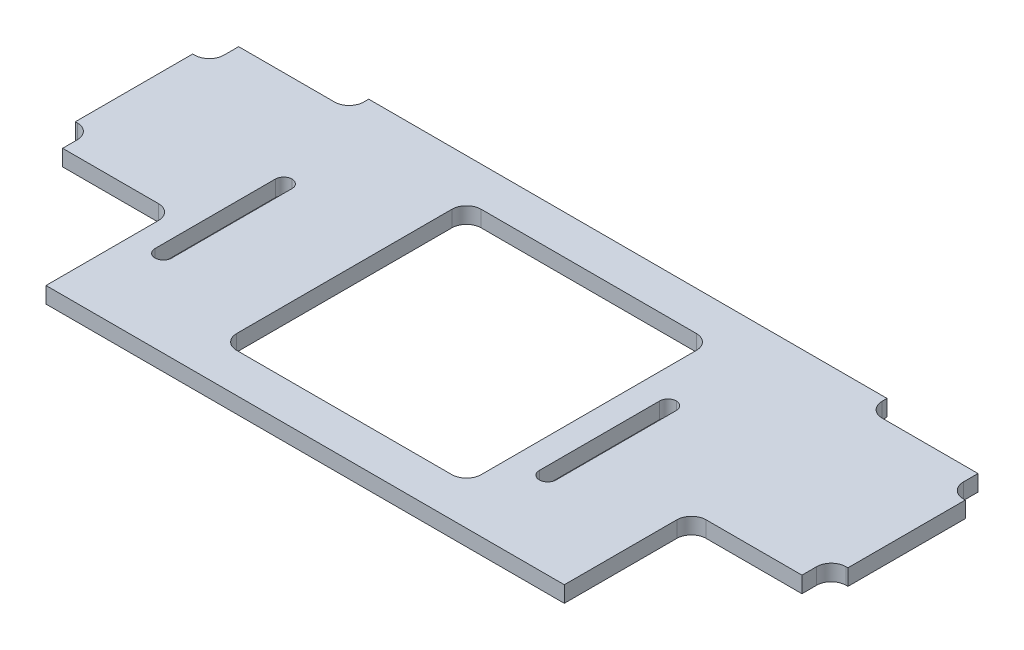
from build123d import *

# Parameters (mm, degrees)
SKIZZE1_W                       = 1.7
SKIZZE1_H                       = 14
SKIZZE1_W_2                     = 25
SKIZZE1_H_2                     = 25
AUFSATZ_LINEAR_AUSTRAGEN1_DEPTH = 0.825
VERRUNDUNG1_R                   = 1.5
VERRUNDUNG2_R                   = 0.85


with BuildPart() as part:
    # Skizze1 → Aufsatz-Linear austragen1 (new, symmetric)
    # profile 1 of 3: a face of its own
    with BuildSketch(Plane(origin=(0, 0, 0), x_dir=(1, 0, 0), z_dir=(0, 1, 0))):
        Polygon((26.5, 16), (26.5, 18), (-26.5, 18), (-26.5, 16), (-26.5, -2), (-26.5, -15), (26.5, -15), (26.5, -2), align=None)
        with Locations((-23.35, 0)):
            Rectangle(SKIZZE1_W, SKIZZE1_H, mode=Mode.SUBTRACT)
        with Locations((15.95, 0)):
            Rectangle(SKIZZE1_W, SKIZZE1_H, mode=Mode.SUBTRACT)
        with Locations((0, 1.5)):
            Rectangle(SKIZZE1_W_2, SKIZZE1_H_2, mode=Mode.SUBTRACT)
    # profile 2 of 3: a face of its own
    with BuildSketch(Plane(origin=(0, 0, 0), x_dir=(1, 0, 0), z_dir=(0, 1, 0))):
        Polygon((-26.5, -2), (-26.5, 16), (-37.8, 16), (-37.8, 13), (-39.5, 13), (-39.5, 1), (-37.8, 1), (-37.8, -2), align=None)
    # profile 3 of 3: a face of its own
    with BuildSketch(Plane(origin=(0, 0, 0), x_dir=(1, 0, 0), z_dir=(0, 1, 0))):
        Polygon((37.8, 16), (26.5, 16), (26.5, -2), (37.8, -2), (37.8, 1), (39.5, 1), (39.5, 13), (37.8, 13), align=None)
    extrude(amount=AUFSATZ_LINEAR_AUSTRAGEN1_DEPTH, both=True)

    # Verrundung1
    verrundung1_edges = [part.edges().sort_by_distance(p)[0] for p in [
        (-26.5, 0, 2),
        (-37.8, 0, -1),
        (-37.8, 0, -13),
        (-26.5, 0, -16),
        (26.5, 0, -16),
        (37.8, 0, -13),
        (37.8, 0, -1),
        (26.5, 0, 2),
        (-12.5, 0, -14),
        (-12.5, 0, 11),
        (12.5, 0, 11),
        (12.5, 0, -14),
    ]]
    fillet(verrundung1_edges, radius=VERRUNDUNG1_R)

    # Verrundung2
    verrundung2_edges = [part.edges().sort_by_distance(p)[0] for p in [
        (15.1, 0, 7),
        (16.8, 0, 7),
        (15.1, 0, -7),
        (16.8, 0, -7),
        (-24.2, 0, 7),
        (-22.5, 0, 7),
        (-22.5, 0, -7),
        (-24.2, 0, -7),
    ]]
    fillet(verrundung2_edges, radius=VERRUNDUNG2_R - 0.0001)  # a hair under: the kernel refuses the full size


solid = part.part
